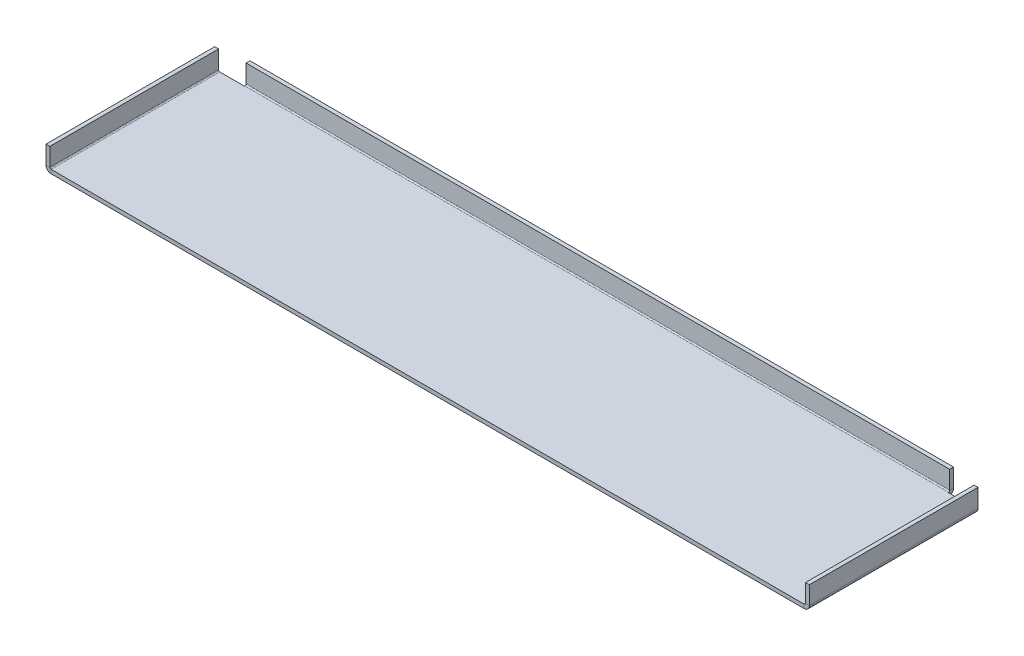
from build123d import *

# Parameters (mm, degrees)
SKETCH1_W               = 614.68
SKETCH1_H               = 138.6205
BASE_FLANGE1_DEPTH      = 3.175
EDGE_FLANGE1_DEPTH      = 138.6205
EDGE_FLANGE1_BEND_DEPTH = 138.6205
EDGE_FLANGE2_DEPTH      = 578.136


# Sheet-metal steps are written as plain solids
with BuildPart() as part:
    # Sketch1 → Base-Flange1 (new body)
    with BuildSketch(Plane(origin=(0, 0, 0), x_dir=(1, 0, 0), z_dir=(0, 1, 0))):
        Rectangle(SKETCH1_W, SKETCH1_H)
    extrude(amount=-BASE_FLANGE1_DEPTH)

    # Edge-Flange1 section (across the edge) → Edge-Flange1 (add)
    with BuildSketch(Plane(origin=(-310.388, 0, -69.31025), x_dir=(1, 0, 0), z_dir=(0, 0, 1))):
        with BuildLine():
            Line((-3.175, 1), (-3.175, 15.875))
            Line((-3.175, 15.875), (0, 15.875))
            Line((0, 15.875), (0, 1))
            ThreePointArc((0, 1), (0.292893219, 0.292893219), (1, 0))
            Line((1, 0), (3.048, 0))
            Line((3.048, 0), (3.048, -3.175))
            Line((3.048, -3.175), (1, -3.175))
            ThreePointArc((1, -3.175), (-1.952170811, -1.952170811), (-3.175, 1))
        make_face()
    extrude(amount=EDGE_FLANGE1_DEPTH)

    # Edge-Flange1 section 2 (across the edge) → Edge-Flange1 bend (add)
    with BuildSketch(Plane(origin=(310.388, 0, 69.31025), x_dir=(-1, 0, 0), z_dir=(0, 0, -1))):
        with BuildLine():
            Line((-3.175, 1), (-3.175, 15.875))
            Line((-3.175, 15.875), (0, 15.875))
            Line((0, 15.875), (0, 1))
            ThreePointArc((0, 1), (0.292893219, 0.292893219), (1, 0))
            Line((1, 0), (3.048, 0))
            Line((3.048, 0), (3.048, -3.175))
            Line((3.048, -3.175), (1, -3.175))
            ThreePointArc((1, -3.175), (-1.952170811, -1.952170811), (-3.175, 1))
        make_face()
    extrude(amount=EDGE_FLANGE1_BEND_DEPTH)

    # Edge-Flange2 section (across the edge) → Edge-Flange2 (add)
    with BuildSketch(Plane(origin=(289.068, 0, -70.58025), x_dir=(0, 0, 1), z_dir=(-1, 0, 0))):
        with BuildLine():
            Line((-3.175, 1), (-3.175, 15.875))
            Line((-3.175, 15.875), (0, 15.875))
            Line((0, 15.875), (0, 1))
            ThreePointArc((0, 1), (0.292893219, 0.292893219), (1, 0))
            Line((1, 0), (1.27, 0))
            Line((1.27, 0), (1.27, -3.175))
            Line((1.27, -3.175), (1, -3.175))
            ThreePointArc((1, -3.175), (-1.952170811, -1.952170811), (-3.175, 1))
        make_face()
    extrude(amount=EDGE_FLANGE2_DEPTH)


solid = part.part
